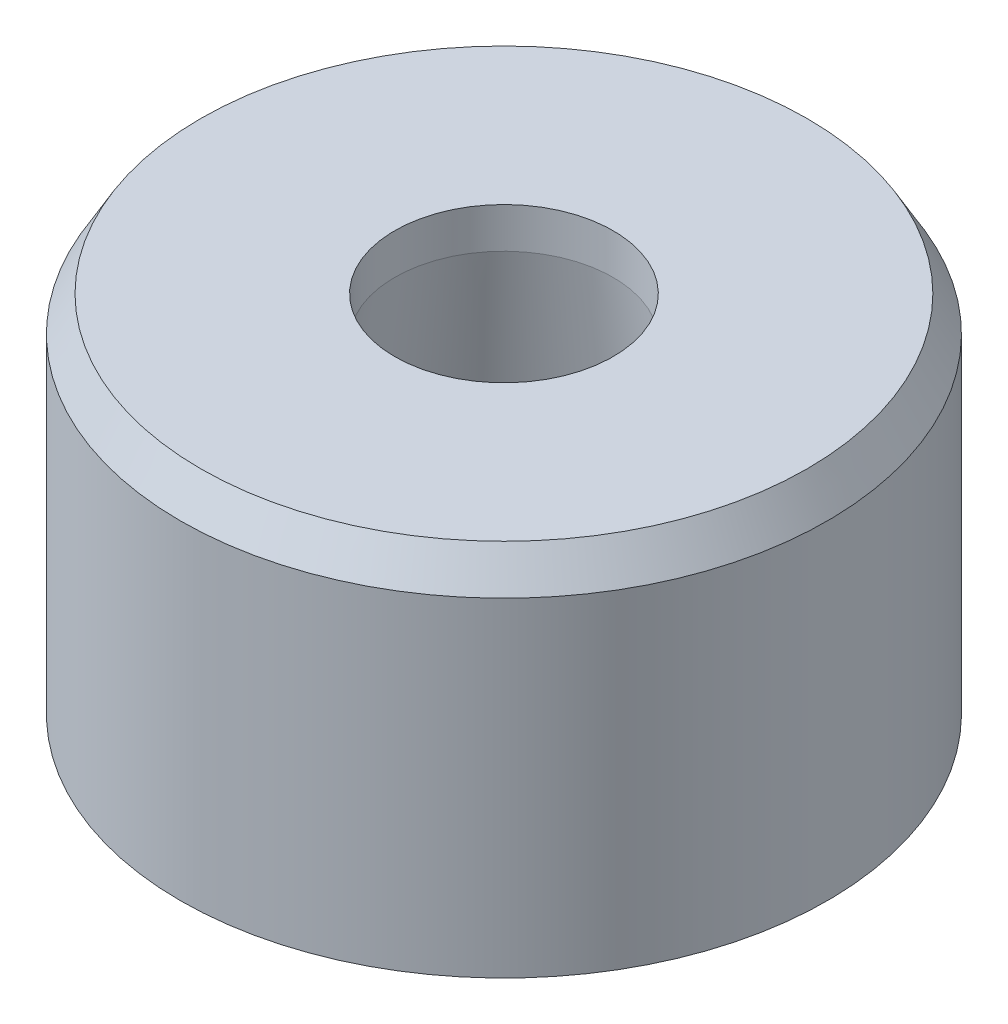
from build123d import *

# Parameters (mm, degrees)
SKETCH1_R           = 8
SKETCH1_R_2         = 2.7
BOSS_EXTRUDE1_DEPTH = 9
CHAMFER1_SIZE       = 8
CHAMFER1_SIZE2      = 1.124326678
CHAMFER2_SIZE       = 0.5
CHAMFER2_SIZE2      = 0.866025404


with BuildPart() as part:
    # Sketch1 → Boss-Extrude1 (new body)
    with BuildSketch(Plane(origin=(0, 0, 0), x_dir=(1, 0, 0), z_dir=(0, 1, 0))):
        Circle(SKETCH1_R)
        Circle(SKETCH1_R_2, mode=Mode.SUBTRACT)
    extrude(amount=BOSS_EXTRUDE1_DEPTH)

    # Chamfer1
    chamfer1_edges = [part.edges().sort_by_distance(p)[0] for p in [
        (-2.7, 0, 0),
    ]]
    chamfer1_side = [part.faces().sort_by_distance(p)[0] for p in [
        (-2.7, 4.5, 0),
    ]]
    chamfer(chamfer1_edges, length=CHAMFER1_SIZE, length2=CHAMFER1_SIZE2, reference=chamfer1_side[0])

    # Chamfer2
    chamfer2_edges = [part.edges().sort_by_distance(p)[0] for p in [
        (-8, 9, 0),
    ]]
    chamfer2_side = [part.faces().sort_by_distance(p)[0] for p in [
        (-7.77372583, 9, 0),
    ]]
    chamfer(chamfer2_edges, length=CHAMFER2_SIZE, length2=CHAMFER2_SIZE2, reference=chamfer2_side[0])


solid = part.part
